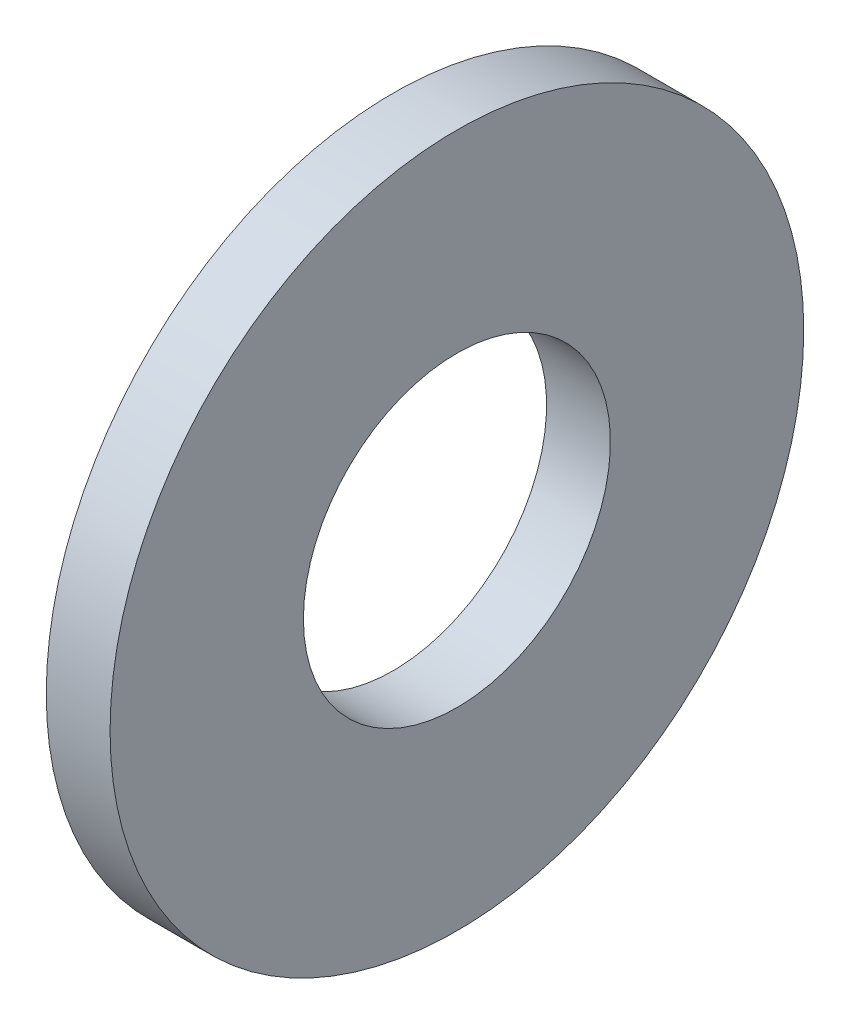
from build123d import *

# Parameters (mm, degrees)
SKETCH1_W = 4.6
SKETCH1_H = 13.935


with BuildPart() as part:
    # Sketch1 → Base-Revolve (revolve)
    with BuildSketch(Plane.XY):
        with Locations((-2.3, 18.0325)):
            Rectangle(SKETCH1_W, SKETCH1_H)
    revolve(axis=Axis((-34.925, 0, 0), (1, 0, 0)))


solid = part.part
